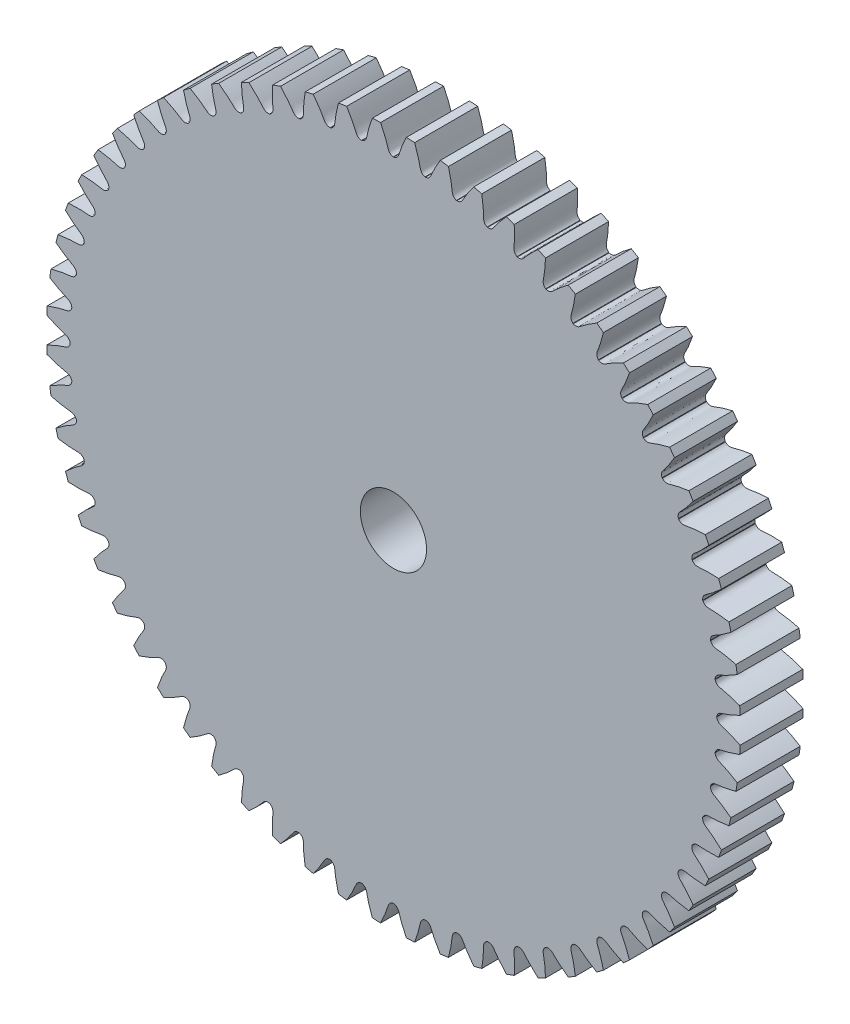
from build123d import *

# Parameters (mm, degrees)
SKETCH_1_R               = 16.5
EXTRUDE_1_DEPTH          = 3
CUT_EXTRUDE_1_DEPTH      = 24.526580712
PATTERN_CIRCULAR_1_COUNT = 64
SKETCH_4_R               = 5
EXTRUDE_2_DEPTH          = 5
CUT_EXTRUDE_2_DEPTH      = 25.652576017
CUT_EXTRUDE_2_DEPTH_BACK = 25.652576017
SKETCH_5_R               = 1.575
CUT_EXTRUDE_3_DEPTH      = 24.848467999
CUT_EXTRUDE_3_DEPTH_BACK = 24.848467999
SKETCH_6_R               = 1
FILLET_1_R               = 1


with BuildPart() as part:
    # 草图1 → 凸台-拉伸1 (new body)
    with BuildSketch(Plane.XY):
        Circle(SKETCH_1_R)
    extrude(amount=EXTRUDE_1_DEPTH)

    # 草图2 → 切除-拉伸1 (cut, through all)
    with BuildSketch(Plane.XY):
        with BuildLine():
            ThreePointArc((0.01, 15.374949418), (0, 15.37495267), (-0.01, 15.374949418))
            add(Edge.make_bspline(
                [(-0.01, 15.374949418), (-0.215037332, 15.416115456), (-0.250290747, 15.593636045), (-0.31783168, 15.79262662), (-0.351113036, 15.886684995), (-0.388568426, 15.985580928), (-0.430181694, 16.089320748), (-0.476225502, 16.197735216), (-0.52688369, 16.310698101), (-0.582361067, 16.428062625), (-0.642851348, 16.549680016), (-0.70854621, 16.675394282), (-0.779632467, 16.805043848), (-0.856292678, 16.938461222), (-0.938704772, 17.075473241), (-1.02704195, 17.215901146), (-1.121472521, 17.359560716), (-1.222159756, 17.506262391), (-1.32926174, 17.6558114), (-1.442931234, 17.808007891), (-1.563315527, 17.962647073), (-1.690556318, 18.119519349), (-1.824789524, 18.278410463), (-2.01591228, 18.495675884), (-2.166219232, 18.656413505), (-2.269864459, 18.763018025)],
                knots=[0, 0, 0, 0, 0.106355279, 0.129132493, 0.153371243, 0.17907153, 0.206233354, 0.234856715, 0.264941613, 0.296488047, 0.329496018, 0.363965526, 0.399896571, 0.437289153, 0.476143271, 0.516458926, 0.558236118, 0.601474847, 0.646175112, 0.692336914, 0.739960253, 0.789045129, 0.839591542, 0.891599491, 1, 1, 1, 1], degree=3))
            ThreePointArc((-2.269864459, 18.763018025), (0, 18.899818255), (2.269864459, 18.763018025))
            add(Edge.make_bspline(
                [(0.01, 15.374949418), (0.215037332, 15.416115456), (0.250290747, 15.593636045), (0.31783168, 15.79262662), (0.351113036, 15.886684995), (0.388568426, 15.985580928), (0.430181694, 16.089320748), (0.476225502, 16.197735216), (0.52688369, 16.310698101), (0.582361067, 16.428062625), (0.642851348, 16.549680016), (0.70854621, 16.675394282), (0.779632467, 16.805043848), (0.856292678, 16.938461222), (0.938704772, 17.075473241), (1.02704195, 17.215901146), (1.121472521, 17.359560716), (1.222159756, 17.506262391), (1.32926174, 17.6558114), (1.442931234, 17.808007891), (1.563315527, 17.962647073), (1.690556318, 18.119519349), (1.824789524, 18.278410463), (2.01591228, 18.495675884), (2.166219232, 18.656413505), (2.269864459, 18.763018025)],
                knots=[0, 0, 0, 0, 0.106355279, 0.129132493, 0.153371243, 0.17907153, 0.206233354, 0.234856715, 0.264941613, 0.296488047, 0.329496018, 0.363965526, 0.399896571, 0.437289153, 0.476143271, 0.516458926, 0.558236118, 0.601474847, 0.646175112, 0.692336914, 0.739960253, 0.789045129, 0.839591542, 0.891599491, 1, 1, 1, 1], degree=3))
        make_face()
    cut_extrude_1 = extrude(amount=CUT_EXTRUDE_1_DEPTH, mode=Mode.SUBTRACT)

    # 阵列(圆周)1: 切除-拉伸1 ×64 about axis
    pattern_circular_1_axis = Axis((0, 0, -0.15), (0, 0, 1))
    for i in range(1, PATTERN_CIRCULAR_1_COUNT):
        add(cut_extrude_1.rotate(pattern_circular_1_axis, i * 360 / PATTERN_CIRCULAR_1_COUNT), mode=Mode.SUBTRACT)

    # 草图4 → 凸台-拉伸2 (add)
    with BuildSketch(Plane(origin=(0, 0, 0), x_dir=(-1, 0, 0), z_dir=(0, 0, -1))):
        Circle(SKETCH_4_R)
    extrude(amount=EXTRUDE_2_DEPTH)

    # 草图5 → 切除-拉伸2 (cut, two sides: drawn at the far end of the back side and taken through both)
    with BuildSketch(Plane(origin=(0, 0, -5), x_dir=(-1, 0, 0), z_dir=(0, 0, -1)).offset(-CUT_EXTRUDE_2_DEPTH_BACK)):
        Circle(SKETCH_5_R)
    extrude(amount=CUT_EXTRUDE_2_DEPTH + CUT_EXTRUDE_2_DEPTH_BACK, mode=Mode.SUBTRACT)

    # 草图6 → 切除-拉伸3 (cut, two sides: drawn at the far end of the back side and taken through both)
    with BuildSketch(Plane(origin=(0, 0, 0), x_dir=(1, 0, 0), z_dir=(0, 1, 0)).offset(-CUT_EXTRUDE_3_DEPTH_BACK)):
        with Locations((0, 2.5)):
            Circle(SKETCH_6_R)
    extrude(amount=CUT_EXTRUDE_3_DEPTH + CUT_EXTRUDE_3_DEPTH_BACK, mode=Mode.SUBTRACT)

    # 圆角1
    fillet_1_edges = [part.edges().sort_by_distance(p)[0] for p in [
        (5, 0, 0),
    ]]
    fillet(fillet_1_edges, radius=FILLET_1_R)


solid = part.part
